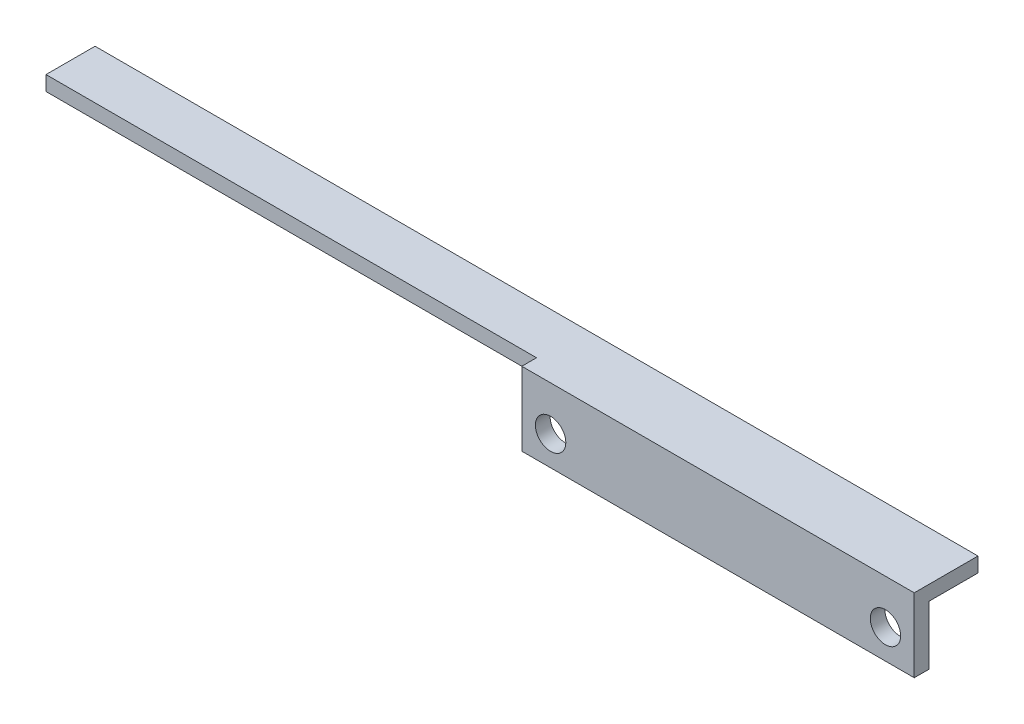
from build123d import *

# Parameters (mm, degrees)
SKETCH_1_W      = 40
SKETCH_1_H      = 6
SKETCH_1_R      = 1.55
EXTRUDE_1_DEPTH = 1.5
SKETCH_2_W      = 40
SKETCH_2_H      = 1.5
EXTRUDE_2_DEPTH = 1.5
SKETCH_4_W      = 40
SKETCH_4_H      = 1.5
EXTRUDE_3_DEPTH = 5
SKETCH_6_W      = 5
SKETCH_6_H      = 1.5
EXTRUDE_4_DEPTH = 50


with BuildPart() as part:
    # 草图1 → 凸台-拉伸1 (new body)
    with BuildSketch(Plane.XY):
        Rectangle(SKETCH_1_W, SKETCH_1_H)
        with Locations((-17.066, 0)):
            Circle(SKETCH_1_R, mode=Mode.SUBTRACT)
        with Locations((17.066, 0)):
            Circle(SKETCH_1_R, mode=Mode.SUBTRACT)
    extrude(amount=EXTRUDE_1_DEPTH)

    # 草图2 → 凸台-拉伸2 (add)
    with BuildSketch(Plane(origin=(0, 3, 0), x_dir=(1, 0, 0), z_dir=(0, 1, 0))):
        with Locations((0, -0.75)):
            Rectangle(SKETCH_2_W, SKETCH_2_H)
    extrude(amount=EXTRUDE_2_DEPTH)

    # 草图4 → 凸台-拉伸3 (add)
    with BuildSketch(Plane(origin=(0, 0, 0), x_dir=(-1, 0, 0), z_dir=(0, 0, -1))):
        with Locations((0, 3.75)):
            Rectangle(SKETCH_4_W, SKETCH_4_H)
    extrude(amount=EXTRUDE_3_DEPTH)

    # 草图6 → 凸台-拉伸4 (add)
    with BuildSketch(Plane.ZY.offset(20)):
        with Locations((-2.5, 3.75)):
            Rectangle(SKETCH_6_W, SKETCH_6_H)
    extrude(amount=EXTRUDE_4_DEPTH)


solid = part.part
